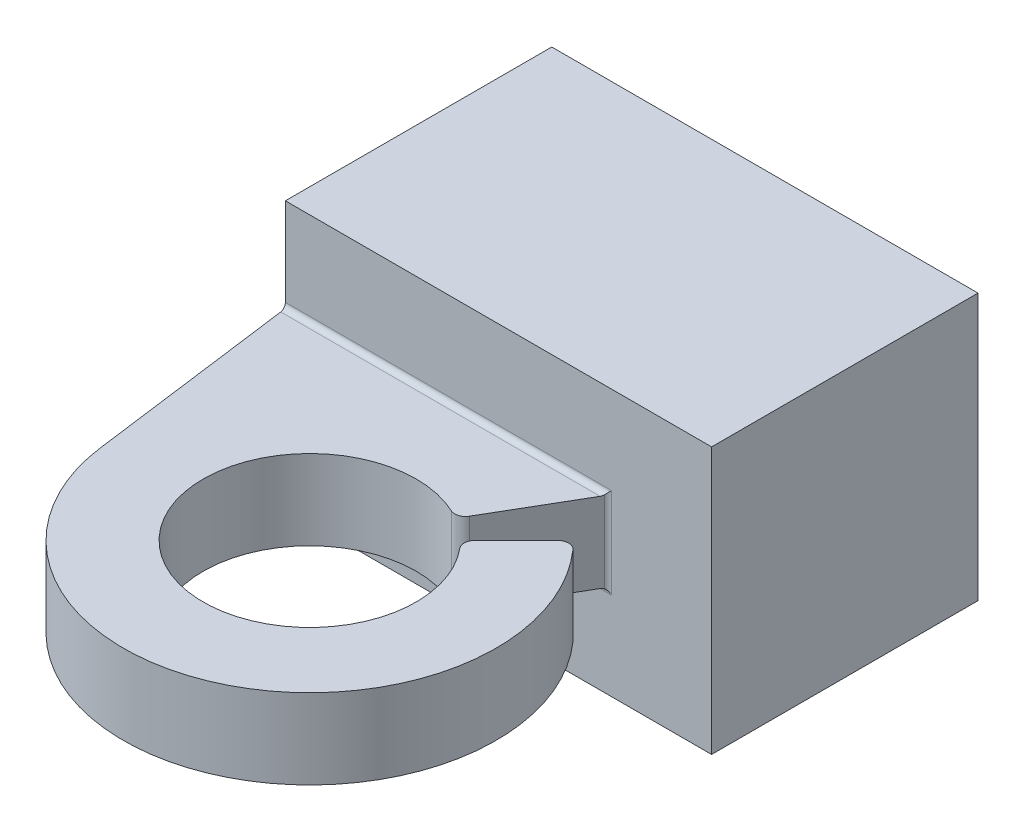
from build123d import *

# Parameters (mm, degrees)
SKETCH_1_W             = 5
SKETCH_1_H             = 5
EXTRUDE_1_DEPTH        = 8
EXTRUDE_3_DEPTH        = 0.75
FILLET_2_R             = 0.2
FILLET_3_R             = 0.2
SKETCH_5_W             = 4
SKETCH_5_H             = 4
CUT_EXTRUDE_1_DEPTH    = 7
SKETCH_6_W             = 6
SKETCH_6_H             = 0.3
EXTRUDE_4_DEPTH        = 0.6
FILLET_4_R             = 0.1
FILLET_4_OF_MIRROR_1_R = 0.1
FILLET_5_R             = 0.1


# Some blends are built 0.0001 mm under size
with BuildPart() as part:
    # 草图1 → 凸台-拉伸1 (new body)
    with BuildSketch(Plane(origin=(0, 0, 0), x_dir=(0, 0, -1), z_dir=(1, 0, 0))):
        Rectangle(SKETCH_1_W, SKETCH_1_H)
    extrude(amount=EXTRUDE_1_DEPTH)

    # 草图4 → 凸台-拉伸3 (add, symmetric)
    with BuildSketch(Plane(origin=(0, 0, 0), x_dir=(1, 0, 0), z_dir=(0, 1, 0))):
        with BuildLine():
            Line((0, -2.5), (0.530317969, -6.502851582))
            ThreePointArc((0.530317969, -6.502851582), (5.54929459, -9.181591589), (6.474873734, -3.56829687))
            Line((6.474873734, -3.56829687), (5.414213562, -4.628957042))
            ThreePointArc((5.414213562, -4.628957042), (2.779286251, -7.627423723), (5.006963629, -4.315158958))
            Line((5.006963629, -4.315158958), (6.064710581, -2.5))
            Line((6.064710581, -2.5), (0, -2.5))
        make_face()
    extrude(amount=EXTRUDE_3_DEPTH, both=True)

    # 圆角2
    fillet_2_edges = [part.edges().sort_by_distance(p)[0] for p in [
        (5.414213562, 0, 4.628957042),
        (6.474873734, 0, 3.56829687),
    ]]
    fillet(fillet_2_edges, radius=FILLET_2_R)

    # 圆角3
    fillet_3_edges = [part.edges().sort_by_distance(p)[0] for p in [
        (5.006963629, 0, 4.315158958),
    ]]
    fillet(fillet_3_edges, radius=FILLET_3_R)

    # 草图5 → 切除-拉伸1 (cut)
    with BuildSketch(Plane.ZY):
        Rectangle(SKETCH_5_W, SKETCH_5_H)
    extrude(amount=-CUT_EXTRUDE_1_DEPTH, mode=Mode.SUBTRACT)

    # 草图6 → 凸台-拉伸4 (add)
    with BuildSketch(Plane(origin=(0, 2.5, 0), x_dir=(1, 0, 0), z_dir=(0, 1, 0))):
        with Locations((4, 0)):
            Rectangle(SKETCH_6_W, SKETCH_6_H)
        with Locations((4, 1.205749971)):
            Rectangle(SKETCH_6_W, SKETCH_6_H)
        with Locations((4, -1.205749971)):
            Rectangle(SKETCH_6_W, SKETCH_6_H)
    extrude_4 = extrude(amount=-EXTRUDE_4_DEPTH)

    # 圆角4
    fillet_4_edges = [part.edges().sort_by_distance(p)[0] for p in [
        (1, 1.9, 1.205749971),
        (4, 1.9, 1.355749971),
        (4, 1.9, 1.055749971),
        (1, 1.9, 0),
        (4, 1.9, 0.15),
        (4, 1.9, -0.15),
        (1, 1.9, -1.205749971),
        (4, 1.9, -1.055749971),
        (4, 1.9, -1.355749971),
    ]]
    fillet(fillet_4_edges, radius=FILLET_4_R - 0.0001)  # a hair under: the kernel refuses the full size

    # 镜向1: 凸台-拉伸4 across plane
    add(extrude_4.mirror(Plane.ZX))

    # 圆角4 of 镜向1
    fillet_4_of_mirror_1_edges = [part.edges().sort_by_distance(p)[0] for p in [
        (1, -1.9, 1.205749971),
        (4, -1.9, 1.355749971),
        (4, -1.9, 1.055749971),
        (1, -1.9, 0),
        (4, -1.9, 0.15),
        (4, -1.9, -0.15),
        (1, -1.9, -1.205749971),
        (4, -1.9, -1.055749971),
        (4, -1.9, -1.355749971),
    ]]
    fillet(fillet_4_of_mirror_1_edges, radius=FILLET_4_OF_MIRROR_1_R - 0.0001)  # a hair under: the kernel refuses the full size

    # 圆角5
    # the kernel refuses this fillet: 0.1 mm, written as the material it adds along each edge
    with BuildSketch(Plane(origin=(6.314710581, -0.75, 2.5), x_dir=(0, -1, 0), z_dir=(-1, 0, 0))) as fillet_5_piece_1_section:
        with BuildLine():
            CenterArc((FILLET_5_R, FILLET_5_R), FILLET_5_R, 180, 90)
            Line((0, FILLET_5_R), (0, 0))
            Line((0, 0), (FILLET_5_R, 0))
        make_face()
    fillet_5_piece_1 = extrude(amount=6.314710581, mode=Mode.PRIVATE)
    fillet_5_piece_1 = split(fillet_5_piece_1, bisect_by=Plane(origin=(0.055159567, -0.772671932, 2.916345616), z_dir=(0.9913377232664815, 0, -0.1313374220427252)), keep=Keep.TOP, mode=Mode.PRIVATE)
    fillet_5_piece_1 = split(fillet_5_piece_1, bisect_by=Plane(origin=(5.284914857, -0.772671932, 3.83817752), z_dir=(-0.8640058232036738, 0, -0.5034818144383589)), keep=Keep.TOP, mode=Mode.PRIVATE)
    add(fillet_5_piece_1)
    with BuildSketch(Plane(origin=(6.064710581, 0.75, 2.5), x_dir=(1, 0, 0), z_dir=(0, -1, 0))) as fillet_5_piece_2:
        with BuildLine():
            CenterArc((FILLET_5_R * 0.57466995271, FILLET_5_R), FILLET_5_R, 210.230623586, 59.769376414)
            Line((-FILLET_5_R * 0.289335870494, FILLET_5_R * 0.496518185562), (0, 0))
            Line((0, 0), (FILLET_5_R * 0.57466995271, 0))
        make_face()
    extrude(amount=1.5)
    with BuildSketch(Plane(origin=(6.314710581, 0.75, 2.5), x_dir=(0, 1, 0), z_dir=(-1, 0, 0))) as fillet_5_piece_3_section:
        with BuildLine():
            CenterArc((FILLET_5_R, -FILLET_5_R), FILLET_5_R, 90, 90)
            Line((0, -FILLET_5_R), (0, 0))
            Line((0, 0), (FILLET_5_R, 0))
        make_face()
    fillet_5_piece_3 = extrude(amount=6.314710581, mode=Mode.PRIVATE)
    fillet_5_piece_3 = split(fillet_5_piece_3, bisect_by=Plane(origin=(0.055159567, 0.772671932, 2.916345616), z_dir=(0.9913377232664815, 0, -0.1313374220427252)), keep=Keep.TOP, mode=Mode.PRIVATE)
    fillet_5_piece_3 = split(fillet_5_piece_3, bisect_by=Plane(origin=(5.284914857, 0.772671932, 3.83817752), z_dir=(-0.8640058232036738, 0, -0.5034818144383589)), keep=Keep.TOP, mode=Mode.PRIVATE)
    add(fillet_5_piece_3)
    with BuildSketch(Plane(origin=(6.064710581, 0.75, 2.5), x_dir=(1, 0, 0), z_dir=(0, -1, 0))) as fillet_5_piece_4a_section:
        with BuildLine():
            CenterArc((FILLET_5_R * 0.57466995271, FILLET_5_R), FILLET_5_R, 210.230623586, 59.769376414)
            Line((-FILLET_5_R * 0.289335870494, FILLET_5_R * 0.496518185562), (0, 0))
            Line((0, 0), (FILLET_5_R * 0.57466995271, 0))
        make_face()
    fillet_5_piece_4a = extrude(amount=1.643667488, mode=Mode.PRIVATE)
    fillet_5_piece_4a = split(fillet_5_piece_4a, bisect_by=Plane(origin=(6.070891015, -0.75, 2.510754755), z_dir=(0, -1, 0)), keep=Keep.TOP, mode=Mode.PRIVATE)
    with BuildSketch(Plane(origin=(6.314710581, -0.75, 2.5), x_dir=(0, -1, 0), z_dir=(-1, 0, 0))) as fillet_5_piece_4b_section:
        with BuildLine():
            CenterArc((FILLET_5_R, FILLET_5_R), FILLET_5_R, 180, 90)
            Line((0, FILLET_5_R), (0, 0))
            Line((0, 0), (FILLET_5_R, 0))
        make_face()
    fillet_5_piece_4b = extrude(amount=6.314710581, mode=Mode.PRIVATE)
    fillet_5_piece_4b = split(fillet_5_piece_4b, bisect_by=Plane(origin=(6.084353102, -0.772031599, 2.466292222), z_dir=(0.8640058232036738, 0, 0.5034818144383589)), keep=Keep.TOP, mode=Mode.PRIVATE)
    fillet_5_piece_4 = fillet_5_piece_4a & fillet_5_piece_4b
    add(fillet_5_piece_4)
    with BuildSketch(Plane(origin=(6.314710581, 0.75, 2.5), x_dir=(0, 1, 0), z_dir=(-1, 0, 0))) as fillet_5_piece_5a_section:
        with BuildLine():
            CenterArc((FILLET_5_R, -FILLET_5_R), FILLET_5_R, 90, 90)
            Line((0, -FILLET_5_R), (0, 0))
            Line((0, 0), (FILLET_5_R, 0))
        make_face()
    fillet_5_piece_5a = extrude(amount=6.314710581, mode=Mode.PRIVATE)
    fillet_5_piece_5a = split(fillet_5_piece_5a, bisect_by=Plane(origin=(6.084353102, 0.772031599, 2.466292222), z_dir=(0.8640058232036738, 0, 0.5034818144383589)), keep=Keep.TOP, mode=Mode.PRIVATE)
    with BuildSketch(Plane(origin=(6.064710581, 0.893667488, 2.5), x_dir=(1, 0, 0), z_dir=(0, -1, 0))) as fillet_5_piece_5b_section:
        with BuildLine():
            CenterArc((FILLET_5_R * 0.57466995271, FILLET_5_R), FILLET_5_R, 210.230623586, 59.769376414)
            Line((-FILLET_5_R * 0.289335870494, FILLET_5_R * 0.496518185562), (0, 0))
            Line((0, 0), (FILLET_5_R * 0.57466995271, 0))
        make_face()
    fillet_5_piece_5b = extrude(amount=1.643667488, mode=Mode.PRIVATE)
    fillet_5_piece_5b = split(fillet_5_piece_5b, bisect_by=Plane(origin=(6.070891015, 0.75, 2.510754755), z_dir=(0, 1, 0)), keep=Keep.TOP, mode=Mode.PRIVATE)
    fillet_5_piece_5 = fillet_5_piece_5a & fillet_5_piece_5b
    add(fillet_5_piece_5)


solid = part.part
